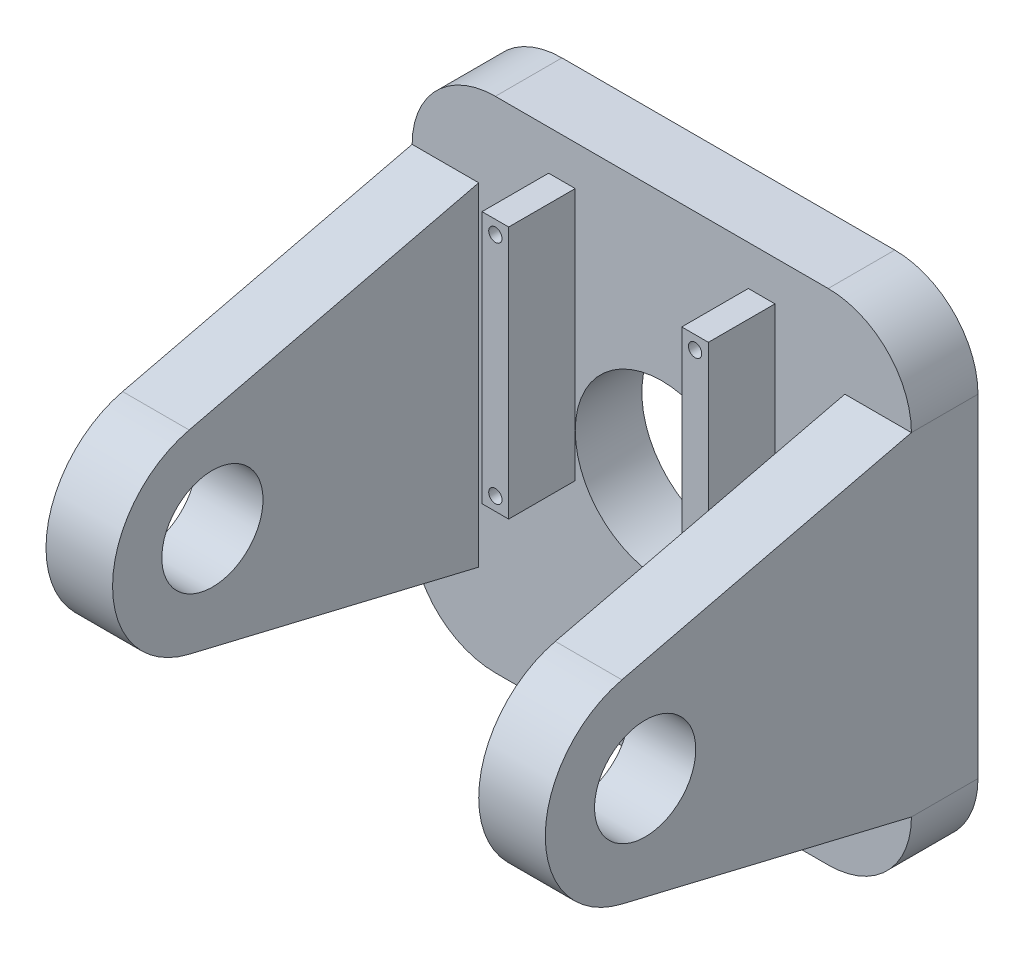
from build123d import *

# Parameters (mm, degrees)
BOSS_EXTRUDE1_DEPTH = 10
SKETCH2_R           = 7.6
BOSS_EXTRUDE2_DEPTH = 10
SKETCH4_R           = 13
CUT_EXTRUDE2_DEPTH  = 77.40353395
SKETCH5_W           = 4
SKETCH5_H           = 38
SKETCH5_R           = 1
BOSS_EXTRUDE3_DEPTH = 10


with BuildPart() as part:
    # Sketch1 → Boss-Extrude1 (new body)
    with BuildSketch(Plane(origin=(0, 0, 0), x_dir=(0, 1, 0), z_dir=(0, 0, 1))):
        with BuildLine():
            Line((-25, -37.5), (25, -37.5))
            ThreePointArc((25, -37.5), (33.838834765, -33.838834765), (37.5, -25))
            Line((37.5, -25), (37.5, 25))
            ThreePointArc((37.5, 25), (33.838834765, 33.838834765), (25, 37.5))
            Line((25, 37.5), (-25, 37.5))
            ThreePointArc((-25, 37.5), (-33.838834765, 33.838834765), (-37.5, 25))
            Line((-37.5, 25), (-37.5, -25))
            ThreePointArc((-37.5, -25), (-33.838834765, -33.838834765), (-25, -37.5))
        make_face()
    extrude(amount=BOSS_EXTRUDE1_DEPTH)

    # Sketch2 → Boss-Extrude2 (add)
    with BuildSketch(Plane.YZ.offset(37.5)):
        with BuildLine():
            ThreePointArc((14.587782351, 53.492363969), (0, 65), (-14.587782351, 53.492363969))
            Line((-14.587782351, 53.492363969), (-25, 10))
            Line((-25, 10), (25, 10))
            Line((25, 10), (14.587782351, 53.492363969))
        make_face()
        with Locations((0, 50)):
            Circle(SKETCH2_R, mode=Mode.SUBTRACT)
    boss_extrude2 = extrude(amount=-BOSS_EXTRUDE2_DEPTH)

    # Mirror1: Boss-Extrude2 across plane
    add(boss_extrude2.mirror(Plane(origin=(0, 0, 0), x_dir=(0, 0, 1), z_dir=(1, 0, 0))))

    # Sketch4 → Cut-Extrude2 (cut, through all)
    with BuildSketch(Plane.XY.offset(10)):
        Circle(SKETCH4_R)
    extrude(amount=-CUT_EXTRUDE2_DEPTH, mode=Mode.SUBTRACT)

    # Sketch5 → Boss-Extrude3 (add)
    # profile 1 of 2: a face of its own
    with BuildSketch(Plane.XY.offset(10)):
        with Locations((-15, 12.5)):
            Rectangle(SKETCH5_W, SKETCH5_H)
        with Locations((-15, -4.5)):
            Circle(SKETCH5_R, mode=Mode.SUBTRACT)
        with Locations((-15, 29.5)):
            Circle(SKETCH5_R, mode=Mode.SUBTRACT)
    # profile 2 of 2: a face of its own
    with BuildSketch(Plane.XY.offset(10)):
        with Locations((15, 12.5)):
            Rectangle(SKETCH5_W, SKETCH5_H)
        with Locations((15, -4.5)):
            Circle(SKETCH5_R, mode=Mode.SUBTRACT)
        with Locations((15, 29.5)):
            Circle(SKETCH5_R, mode=Mode.SUBTRACT)
    extrude(amount=BOSS_EXTRUDE3_DEPTH)


solid = part.part
